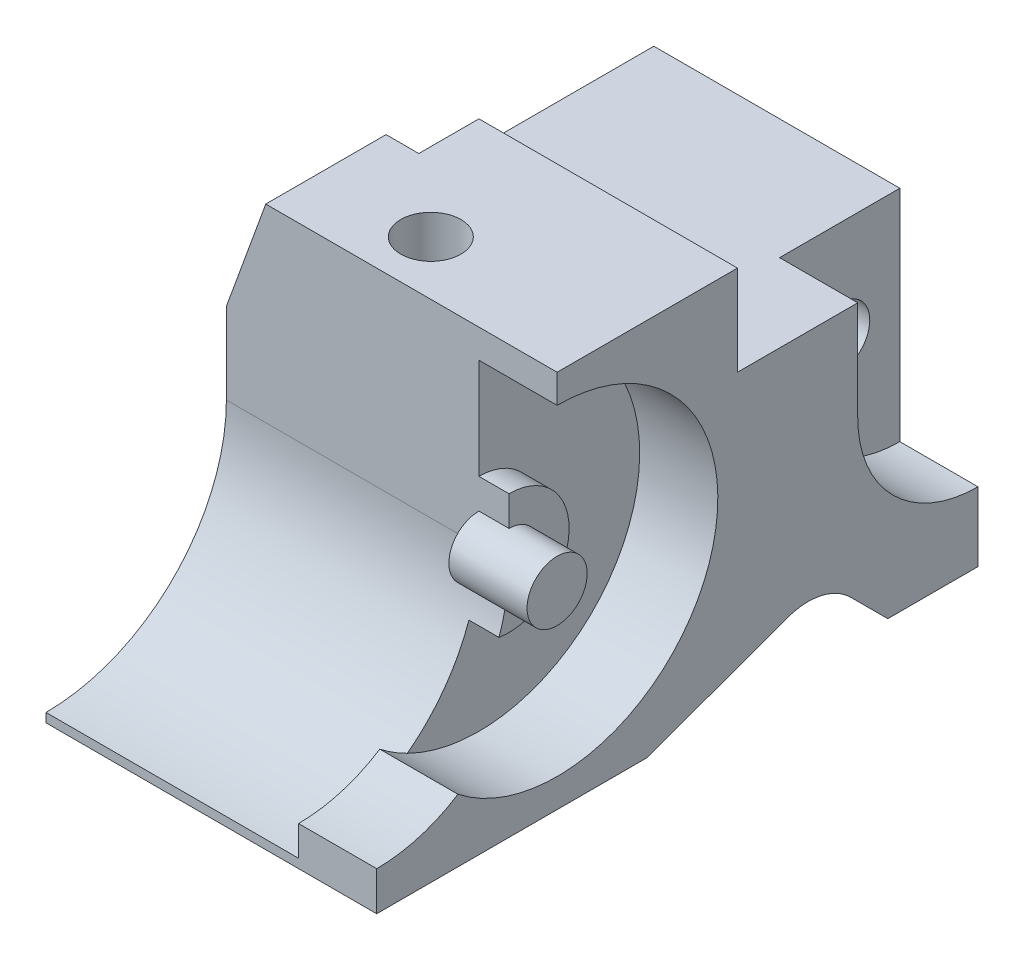
from build123d import *

# Parameters (mm, degrees)
BOSS_EXTRUDE4_DEPTH = 13
BOSS_EXTRUDE5_DEPTH = 5
FILLET2_R           = 20
BOSS_EXTRUDE6_START = -42
SKETCH2_7_R         = 5
BOSS_EXTRUDE6_DEPTH = 42
SKETCH5_R           = 25
CUT_EXTRUDE1_DEPTH  = 42
SKETCH7_W           = 12
SKETCH7_H           = 10
CUT_EXTRUDE2_DEPTH  = 239
SKETCH8_R           = 5
CUT_EXTRUDE3_DEPTH  = 130
CUT_EXTRUDE4_DEPTH  = 130
CUT_EXTRUDE6_DEPTH  = 37


with BuildPart() as part:
    # Sketch2 → Boss-Extrude4 (new body)
    with BuildSketch(Plane(origin=(0, 0, 0), x_dir=(0, 0, -1), z_dir=(1, 0, 0))):
        with BuildLine():
            Line((0, 31.5), (0, 26.733616794))
            ThreePointArc((0, 26.733616794), (26.024128556, -6.118087921), (-11.911437782, -23.933322312))
            ThreePointArc((-11.911437782, -23.933322312), (-20.46059932, -28.4429224), (-30, -30))
            Line((-30, -30), (-30, -31.5))
            Line((-30, -31.5), (15, -31.5))
            Line((15, -31.5), (38.339650933, -23.005061782))
            ThreePointArc((38.339650933, -23.005061782), (43.924248506, -22.639027919), (48.830920178, -25.330920178))
            Line((48.830920178, -25.330920178), (55, -31.5))
            Line((55, -31.5), (70, -31.5))
            Line((70, -31.5), (70, -20))
            Line((70, -20), (50, -20))
            Line((50, -20), (50, 16.5))
            Line((50, 16.5), (30, 16.5))
            Line((30, 16.5), (30, 31.5))
            Line((30, 31.5), (0, 31.5))
        make_face()
        with BuildLine():
            ThreePointArc((5, 0), (3.535533906, 3.535533906), (0, 5))
            Line((0, 5), (0, 0))
            ThreePointArc((0, 0), (-0.104348142, -2.5), (-0.416666667, -4.982608643))
            ThreePointArc((-0.416666667, -4.982608643), (3.385016002, -3.679900361), (5, 0))
        make_face()
        with BuildLine():
            Line((0, 0), (0, 5))
            ThreePointArc((0, 5), (-3.549297202, 3.521716822), (-4.999847865, -0.03900425))
            ThreePointArc((-4.999847865, -0.03900425), (-3.666669267, -3.399343537), (-0.416666667, -4.982608643))
            ThreePointArc((-0.416666667, -4.982608643), (-0.104348142, -2.5), (0, 0))
        make_face()
        with BuildLine():
            ThreePointArc((-30, -30), (-20.46059932, -28.4429224), (-11.911437782, -23.933322312))
            ThreePointArc((-11.911437782, -23.933322312), (-15.61180413, -21.701563048), (-18.904262251, -18.902781162))
            ThreePointArc((-18.904262251, -18.902781162), (-24.302172741, -20.842036984), (-30, -21.5))
            Line((-30, -21.5), (-30, -30))
        make_face()
    extrude(amount=BOSS_EXTRUDE4_DEPTH)

    # Sketch2<6> → Boss-Extrude5 (add)
    with BuildSketch(Plane(origin=(0, 0, 0), x_dir=(0, 0, -1), z_dir=(1, 0, 0))):
        with BuildLine():
            ThreePointArc((-1.666666667, -9.860132972), (9.964971895, -0.836262603), (0, 10))
            Line((0, 10), (0, 5))
            ThreePointArc((0, 5), (3.535533906, 3.535533906), (5, 0))
            ThreePointArc((5, 0), (3.385016002, -3.679900361), (-0.416666667, -4.982608643))
            ThreePointArc((-0.416666667, -4.982608643), (-0.939156407, -7.447641886), (-1.666666667, -9.860132972))
        make_face()
    extrude(amount=BOSS_EXTRUDE5_DEPTH)

    # Fillet2
    fillet2_edges = [part.edges().sort_by_distance(p)[0] for p in [
        (6.5, -20, -50),
    ]]
    fillet(fillet2_edges, radius=FILLET2_R - 0.0001)  # a hair under: the kernel refuses the full size

    # Sketch2<7> → Boss-Extrude6 (add)
    with BuildSketch(Plane(origin=(0, 0, 0), x_dir=(0, 0, -1), z_dir=(1, 0, 0)).offset(BOSS_EXTRUDE6_START)):
        with BuildLine():
            Line((-30, -30), (-30, -31.5))
            Line((-30, -31.5), (15, -31.5))
            Line((15, -31.5), (38.339650933, -23.005061782))
            ThreePointArc((38.339650933, -23.005061782), (43.924248506, -22.639027919), (48.830920178, -25.330920178))
            Line((48.830920178, -25.330920178), (55, -31.5))
            Line((55, -31.5), (70, -31.5))
            Line((70, -31.5), (70, 16.5))
            Line((70, 16.5), (30, 16.5))
            Line((30, 16.5), (30, 31.5))
            Line((30, 31.5), (0, 31.5))
            Line((0, 31.5), (0, 0))
            ThreePointArc((0, 0), (-8.786796564, -21.213203436), (-30, -30))
        make_face()
        with Locations((60, 0)):
            Circle(SKETCH2_7_R, mode=Mode.SUBTRACT)
    extrude(amount=BOSS_EXTRUDE6_DEPTH)

    # Sketch5 → Cut-Extrude1 (cut)
    with BuildSketch(Plane(origin=(13, 0, 0), x_dir=(0, 0, -1), z_dir=(1, 0, 0))):
        with Locations((-30, 0)):
            Circle(SKETCH5_R)
    extrude(amount=-CUT_EXTRUDE1_DEPTH, mode=Mode.SUBTRACT)

    # Sketch7 → Cut-Extrude2 (cut)
    with BuildSketch(Plane(origin=(0, 31.5, 0), x_dir=(1, 0, 0), z_dir=(0, 1, 0))):
        with Locations((-36, 25)):
            Rectangle(SKETCH7_W, SKETCH7_H)
    extrude(amount=-CUT_EXTRUDE2_DEPTH, mode=Mode.SUBTRACT)

    # Sketch8 → Cut-Extrude3 (cut)
    with BuildSketch(Plane(origin=(0, 31.5, 0), x_dir=(1, 0, 0), z_dir=(0, 1, 0))):
        with Locations(Location((-17, 9, 0), (0, 0, 270))):
            Circle(SKETCH8_R)
    extrude(amount=-CUT_EXTRUDE3_DEPTH, mode=Mode.SUBTRACT)

    # Sketch9 → Cut-Extrude4 (cut)
    with BuildSketch(Plane.XY):
        Polygon((-42, 31.5), (-42, 13.5), (-35.448535783, 31.5), align=None)
    extrude(amount=-CUT_EXTRUDE4_DEPTH, mode=Mode.SUBTRACT)

    # Sketch10 → Cut-Extrude6 (cut)
    with BuildSketch(Plane.ZY.offset(42)):
        Polygon((-0.667060513, 13.5), (-20, 13.5), (-20, -29.680148829), (-15, -31.5), (-0.667060513, -31.5), align=None)
    extrude(amount=-CUT_EXTRUDE6_DEPTH, mode=Mode.SUBTRACT)


solid = part.part
